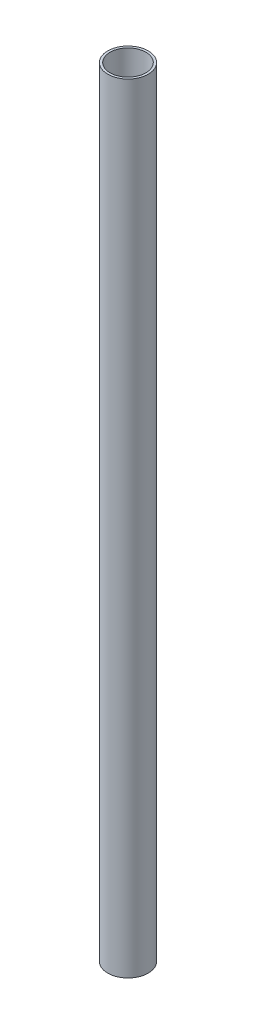
from build123d import *

# Parameters (mm, degrees)
SKETCH_1_R          = 13
EXTRUDE_1_DEPTH     = 20
SKETCH_2_R          = 13
EXTRUDE_2_DEPTH     = 480
SKETCH_4_R          = 11.5
CUT_EXTRUDE_1_DEPTH = 501.337885833


with BuildPart() as part:
    # 草图1 → 凸台-拉伸1 (new body)
    with BuildSketch(Plane(origin=(0, 0, 0), x_dir=(1, 0, 0), z_dir=(0, 1, 0))):
        Circle(SKETCH_1_R)
    extrude(amount=EXTRUDE_1_DEPTH)

    # 草图2 → 凸台-拉伸2 (add)
    with BuildSketch(Plane(origin=(0, 20, 0), x_dir=(1, 0, 0), z_dir=(0, 1, 0))):
        Circle(SKETCH_2_R)
    extrude(amount=EXTRUDE_2_DEPTH)

    # 草图4 → 切除-拉伸1 (cut, through all)
    with BuildSketch(Plane.XZ):
        Circle(SKETCH_4_R)
    extrude(amount=-CUT_EXTRUDE_1_DEPTH, mode=Mode.SUBTRACT)


solid = part.part
